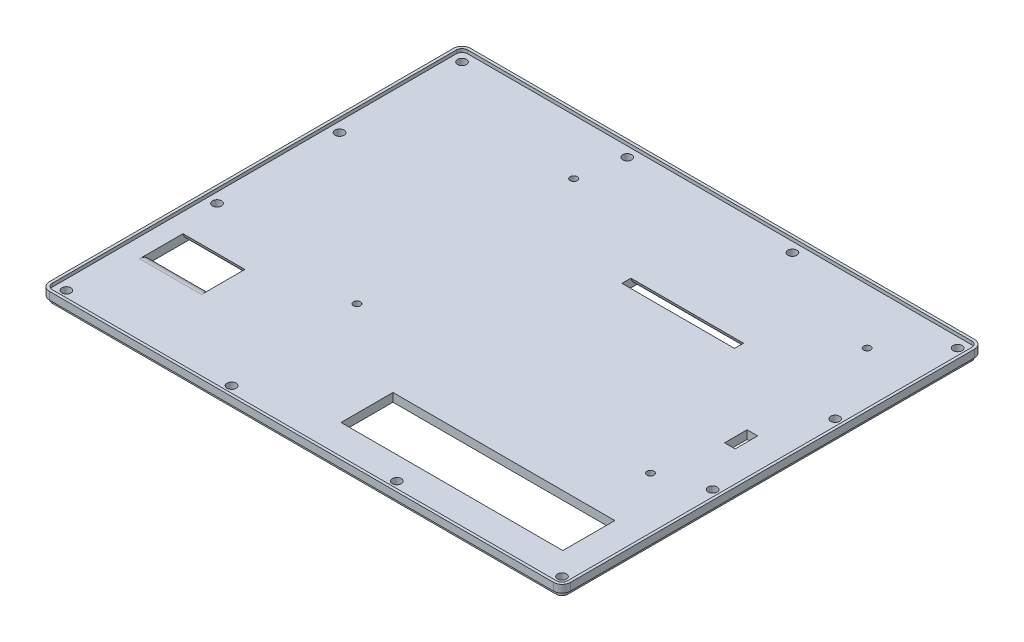
from build123d import *

# Parameters (mm, degrees)
SKETCH1_W           = 164.87
SKETCH1_H           = 104.3
SKETCH1_W_2         = 154.97
SKETCH1_H_2         = 94.47
BOSS_EXTRUDE1_DEPTH = 3
CUT_EXTRUDE9_START  = -1.5
CUT_EXTRUDE9_DEPTH  = 1.5
SKETCH8_W           = 78.76
SKETCH8_H           = 18.45
CUT_EXTRUDE7_DEPTH  = 228.052779987
SKETCH3_W           = 22
SKETCH3_H           = 6.55
CUT_EXTRUDE4_DEPTH  = 228.052779987
CUT_EXTRUDE3_REACH  = 229.053
SKETCH2_R           = 1.6
BOSS_EXTRUDE2_START = -4.2
BOSS_EXTRUDE2_DEPTH = 1.2
SKETCH13_W          = 3.75
SKETCH13_H          = 8
SKETCH13_W_2        = 40
SKETCH13_H_2        = 3.2
SKETCH13_W_3        = 22
SKETCH13_H_3        = 5
CUT_EXTRUDE10_DEPTH = 228.071805603
FILLET1_R           = 4
SKETCH15_R          = 4.15
BOSS_EXTRUDE3_DEPTH = 2.2
SKETCH16_R          = 1.25
CUT_EXTRUDE11_DEPTH = 228.123149194


with BuildPart() as part:
    # Sketch1 → Boss-Extrude1 (new body)
    # profile 1 of 3: a face of its own
    with BuildSketch(Plane(origin=(0, 0, 0), x_dir=(1, 0, 0), z_dir=(0, 1, 0))):
        with BuildLine():
            ThreePointArc((174.2, 7.54), (176.321320344, 6.661320344), (177.2, 4.54))
            Line((177.2, 4.54), (177.2, -138.93))
            ThreePointArc((177.2, -138.93), (176.321320344, -141.051320344), (174.2, -141.93))
            Line((174.2, -141.93), (-4.77, -141.93))
            ThreePointArc((-4.77, -141.93), (-6.891320344, -141.051320344), (-7.77, -138.93))
            Line((-7.77, -138.93), (-7.77, 4.54))
            ThreePointArc((-7.77, 4.54), (-6.891320344, 6.661320344), (-4.77, 7.54))
            Line((-4.77, 7.54), (174.2, 7.54))
        make_face()
        with Locations((82.435, -52.15)):
            Rectangle(SKETCH1_W, SKETCH1_H, mode=Mode.SUBTRACT)
    # profile 2 of 3: a face of its own
    with BuildSketch(Plane(origin=(0, 0, 0), x_dir=(1, 0, 0), z_dir=(0, 1, 0))):
        with Locations((82.435, -52.15)):
            Rectangle(SKETCH1_W, SKETCH1_H)
        with Locations((84.715, -54.695)):
            Rectangle(SKETCH1_W_2, SKETCH1_H_2, mode=Mode.SUBTRACT)
    # profile 3 of 3: a face of its own
    with BuildSketch(Plane(origin=(0, 0, 0), x_dir=(1, 0, 0), z_dir=(0, 1, 0))):
        with Locations((84.715, -54.695)):
            Rectangle(SKETCH1_W_2, SKETCH1_H_2)
    extrude(amount=-BOSS_EXTRUDE1_DEPTH)

    # Sketch12 → Cut-Extrude9 (cut)
    with BuildSketch(Plane.XZ.offset(3).offset(CUT_EXTRUDE9_START)):
        with BuildLine():
            Line((-4.77, -7.54), (174.2, -7.54))
            ThreePointArc((174.2, -7.54), (176.321320344, -6.661320344), (177.2, -4.54))
            Line((177.2, -4.54), (177.2, 138.93))
            ThreePointArc((177.2, 138.93), (176.321320344, 141.051320344), (174.2, 141.93))
            Line((174.2, 141.93), (-4.77, 141.93))
            ThreePointArc((-4.77, 141.93), (-6.891320344, 141.051320344), (-7.77, 138.93))
            Line((-7.77, 138.93), (-7.77, -4.54))
            ThreePointArc((-7.77, -4.54), (-6.891320344, -6.661320344), (-4.77, -7.54))
        make_face()
        with BuildLine():
            Line((176.2, -4.54), (176.2, 138.93))
            ThreePointArc((176.2, 138.93), (175.614213562, 140.344213562), (174.2, 140.93))
            Line((174.2, 140.93), (-4.77, 140.93))
            ThreePointArc((-4.77, 140.93), (-6.184213562, 140.344213562), (-6.77, 138.93))
            Line((-6.77, 138.93), (-6.77, -4.54))
            ThreePointArc((-6.77, -4.54), (-6.184213562, -5.954213562), (-4.77, -6.54))
            Line((-4.77, -6.54), (174.2, -6.54))
            ThreePointArc((174.2, -6.54), (175.614213562, -5.954213562), (176.2, -4.54))
        make_face(mode=Mode.SUBTRACT)
    extrude(amount=CUT_EXTRUDE9_DEPTH, mode=Mode.SUBTRACT)

    # Sketch8 → Cut-Extrude7 (cut, through all)
    with BuildSketch(Plane.XZ.offset(3)):
        with Locations((125.49, 120.075)):
            Rectangle(SKETCH8_W, SKETCH8_H)
    extrude(amount=-CUT_EXTRUDE7_DEPTH, mode=Mode.SUBTRACT)

    # Sketch3 → Cut-Extrude4 (cut, through all)
    with BuildSketch(Plane(origin=(0, -3, 0), x_dir=(-1, 0, 0), z_dir=(0, -1, 0))):
        with Locations((-11, -107.575)):
            Rectangle(SKETCH3_W, SKETCH3_H)
    extrude(amount=-CUT_EXTRUDE4_DEPTH, mode=Mode.SUBTRACT)

    # Sketch2 → Cut-Extrude3 (cut, up to next)
    with BuildSketch(Plane.XZ.offset(3), mode=Mode.PRIVATE) as cut_extrude3_sk1:
        with Locations(Location((172.7, -3.04, 0), (0, 0, 270))):
            Circle(SKETCH2_R)
    cut_extrude3_tool1 = extrude(cut_extrude3_sk1.sketch, amount=-CUT_EXTRUDE3_REACH, mode=Mode.PRIVATE) & part.part
    # Sketch2 → Cut-Extrude3 (cut, up to next)
    with BuildSketch(Plane.XZ.offset(3), mode=Mode.PRIVATE) as cut_extrude3_sk2:
        with Locations(Location((114.05, -3.04, 0), (0, 0, 270))):
            Circle(SKETCH2_R)
    cut_extrude3_tool2 = extrude(cut_extrude3_sk2.sketch, amount=-CUT_EXTRUDE3_REACH, mode=Mode.PRIVATE) & part.part
    # Sketch2 → Cut-Extrude3 (cut, up to next)
    with BuildSketch(Plane.XZ.offset(3), mode=Mode.PRIVATE) as cut_extrude3_sk3:
        with Locations(Location((-3.27, -3.04, 0), (0, 0, 270))):
            Circle(SKETCH2_R)
    cut_extrude3_tool3 = extrude(cut_extrude3_sk3.sketch, amount=-CUT_EXTRUDE3_REACH, mode=Mode.PRIVATE) & part.part
    # Sketch2 → Cut-Extrude3 (cut, up to next)
    with BuildSketch(Plane.XZ.offset(3), mode=Mode.PRIVATE) as cut_extrude3_sk4:
        with Locations(Location((-3.27, 83.94, 0), (0, 0, 270))):
            Circle(SKETCH2_R)
    cut_extrude3_tool4 = extrude(cut_extrude3_sk4.sketch, amount=-CUT_EXTRUDE3_REACH, mode=Mode.PRIVATE) & part.part
    # Sketch2 → Cut-Extrude3 (cut, up to next)
    with BuildSketch(Plane.XZ.offset(3), mode=Mode.PRIVATE) as cut_extrude3_sk5:
        with Locations(Location((-3.27, 137.43, 0), (0, 0, 270))):
            Circle(SKETCH2_R)
    cut_extrude3_tool5 = extrude(cut_extrude3_sk5.sketch, amount=-CUT_EXTRUDE3_REACH, mode=Mode.PRIVATE) & part.part
    # Sketch2 → Cut-Extrude3 (cut, up to next)
    with BuildSketch(Plane.XZ.offset(3), mode=Mode.PRIVATE) as cut_extrude3_sk6:
        with Locations(Location((55.38, 137.43, 0), (0, 0, 270))):
            Circle(SKETCH2_R)
    cut_extrude3_tool6 = extrude(cut_extrude3_sk6.sketch, amount=-CUT_EXTRUDE3_REACH, mode=Mode.PRIVATE) & part.part
    # Sketch2 → Cut-Extrude3 (cut, up to next)
    with BuildSketch(Plane.XZ.offset(3), mode=Mode.PRIVATE) as cut_extrude3_sk7:
        with Locations(Location((114.05, 137.43, 0), (0, 0, 270))):
            Circle(SKETCH2_R)
    cut_extrude3_tool7 = extrude(cut_extrude3_sk7.sketch, amount=-CUT_EXTRUDE3_REACH, mode=Mode.PRIVATE) & part.part
    # Sketch2 → Cut-Extrude3 (cut, up to next)
    with BuildSketch(Plane.XZ.offset(3), mode=Mode.PRIVATE) as cut_extrude3_sk8:
        with Locations(Location((172.7, 137.43, 0), (0, 0, 270))):
            Circle(SKETCH2_R)
    cut_extrude3_tool8 = extrude(cut_extrude3_sk8.sketch, amount=-CUT_EXTRUDE3_REACH, mode=Mode.PRIVATE) & part.part
    # Sketch2 → Cut-Extrude3 (cut, up to next)
    with BuildSketch(Plane.XZ.offset(3), mode=Mode.PRIVATE) as cut_extrude3_sk9:
        with Locations(Location((172.7, 83.94, 0), (0, 0, 270))):
            Circle(SKETCH2_R)
    cut_extrude3_tool9 = extrude(cut_extrude3_sk9.sketch, amount=-CUT_EXTRUDE3_REACH, mode=Mode.PRIVATE) & part.part
    # Sketch2 → Cut-Extrude3 (cut, up to next)
    with BuildSketch(Plane.XZ.offset(3), mode=Mode.PRIVATE) as cut_extrude3_sk10:
        with Locations(Location((172.7, 40.45, 0), (0, 0, 270))):
            Circle(SKETCH2_R)
    cut_extrude3_tool10 = extrude(cut_extrude3_sk10.sketch, amount=-CUT_EXTRUDE3_REACH, mode=Mode.PRIVATE) & part.part
    # Sketch2 → Cut-Extrude3 (cut, up to next)
    with BuildSketch(Plane.XZ.offset(3), mode=Mode.PRIVATE) as cut_extrude3_sk11:
        with Locations(Location((55.38, -3.04, 0), (0, 0, 270))):
            Circle(SKETCH2_R)
    cut_extrude3_tool11 = extrude(cut_extrude3_sk11.sketch, amount=-CUT_EXTRUDE3_REACH, mode=Mode.PRIVATE) & part.part
    # Sketch2 → Cut-Extrude3 (cut, up to next)
    with BuildSketch(Plane.XZ.offset(3), mode=Mode.PRIVATE) as cut_extrude3_sk12:
        with Locations(Location((-3.27, 40.45, 0), (0, 0, 270))):
            Circle(SKETCH2_R)
    cut_extrude3_tool12 = extrude(cut_extrude3_sk12.sketch, amount=-CUT_EXTRUDE3_REACH, mode=Mode.PRIVATE) & part.part
    add(cut_extrude3_tool1.solids().sort_by_distance((172.7, -3, -3.04))[0], mode=Mode.SUBTRACT)
    add(cut_extrude3_tool2.solids().sort_by_distance((114.05, -3, -3.04))[0], mode=Mode.SUBTRACT)
    add(cut_extrude3_tool3.solids().sort_by_distance((-3.27, -3, -3.04))[0], mode=Mode.SUBTRACT)
    add(cut_extrude3_tool4.solids().sort_by_distance((-3.27, -3, 83.94))[0], mode=Mode.SUBTRACT)
    add(cut_extrude3_tool5.solids().sort_by_distance((-3.27, -3, 137.43))[0], mode=Mode.SUBTRACT)
    add(cut_extrude3_tool6.solids().sort_by_distance((55.38, -3, 137.43))[0], mode=Mode.SUBTRACT)
    add(cut_extrude3_tool7.solids().sort_by_distance((114.05, -3, 137.43))[0], mode=Mode.SUBTRACT)
    add(cut_extrude3_tool8.solids().sort_by_distance((172.7, -3, 137.43))[0], mode=Mode.SUBTRACT)
    add(cut_extrude3_tool9.solids().sort_by_distance((172.7, -3, 83.94))[0], mode=Mode.SUBTRACT)
    add(cut_extrude3_tool10.solids().sort_by_distance((172.7, -3, 40.45))[0], mode=Mode.SUBTRACT)
    add(cut_extrude3_tool11.solids().sort_by_distance((55.38, -3, -3.04))[0], mode=Mode.SUBTRACT)
    add(cut_extrude3_tool12.solids().sort_by_distance((-3.27, -3, 40.45))[0], mode=Mode.SUBTRACT)

    # Sketch12<2> → Boss-Extrude2 (add)
    with BuildSketch(Plane.XZ.offset(3).offset(BOSS_EXTRUDE2_START)):
        with BuildLine():
            Line((-4.77, -7.54), (174.2, -7.54))
            ThreePointArc((174.2, -7.54), (176.321320344, -6.661320344), (177.2, -4.54))
            Line((177.2, -4.54), (177.2, 138.93))
            ThreePointArc((177.2, 138.93), (176.321320344, 141.051320344), (174.2, 141.93))
            Line((174.2, 141.93), (-4.77, 141.93))
            ThreePointArc((-4.77, 141.93), (-6.891320344, 141.051320344), (-7.77, 138.93))
            Line((-7.77, 138.93), (-7.77, -4.54))
            ThreePointArc((-7.77, -4.54), (-6.891320344, -6.661320344), (-4.77, -7.54))
        make_face()
        with BuildLine():
            Line((176.2, -4.54), (176.2, 138.93))
            ThreePointArc((176.2, 138.93), (175.614213562, 140.344213562), (174.2, 140.93))
            Line((174.2, 140.93), (-4.77, 140.93))
            ThreePointArc((-4.77, 140.93), (-6.184213562, 140.344213562), (-6.77, 138.93))
            Line((-6.77, 138.93), (-6.77, -4.54))
            ThreePointArc((-6.77, -4.54), (-6.184213562, -5.954213562), (-4.77, -6.54))
            Line((-4.77, -6.54), (174.2, -6.54))
            ThreePointArc((174.2, -6.54), (175.614213562, -5.954213562), (176.2, -4.54))
        make_face(mode=Mode.SUBTRACT)
    extrude(amount=BOSS_EXTRUDE2_DEPTH)

    # Sketch13 → Cut-Extrude10 (cut, through all)
    with BuildSketch(Plane(origin=(0, -3, 0), x_dir=(-1, 0, 0), z_dir=(0, -1, 0))):
        with Locations((-162.325, -63.46)):
            Rectangle(SKETCH13_W, SKETCH13_H)
        with Locations((-113.2, -35.06)):
            Rectangle(SKETCH13_W_2, SKETCH13_H_2)
        with Locations((-11, -101.8)):
            Rectangle(SKETCH13_W_3, SKETCH13_H_3)
    extrude(amount=-CUT_EXTRUDE10_DEPTH, mode=Mode.SUBTRACT)

    # Fillet1
    # the kernel refuses this fillet: 4 mm, written as the material it takes off along each edge
    with BuildSketch(Plane(origin=(133.2, -3, 33.46), x_dir=(0, 0, -1), z_dir=(-1, 0, 0))) as fillet1_piece_1:
        with BuildLine():
            CenterArc((3.872983346, -4), FILLET1_R, 90, 75.522487814)
            Line((0, -3), (0, 0))
            Line((0, 0), (3.872983346, 0))
        make_face()
    extrude(amount=40, mode=Mode.SUBTRACT)
    with BuildSketch(Plane(origin=(0, 0, 110.85), x_dir=(0, 0, 1), z_dir=(1, 0, 0)), Plane(origin=(0, -3, 99.3), x_dir=(0, 0, -1), z_dir=(1, 0, 0))) as fillet1_piece_2:
        with BuildLine():
            CenterArc((3.872983346, 4), FILLET1_R, 194.477512186, 75.522487814)
            Line((0, 3), (0, 0))
            Line((0, 0), (3.872983346, 0))
        make_face()
    extrude(amount=22, mode=Mode.SUBTRACT)

    # Sketch15 → Boss-Extrude3 (add)
    with BuildSketch(Plane.XZ.offset(3)):
        with Locations(Location((156.64, 13.02, 0), (0, 0, 90))):
            Circle(SKETCH15_R)
        with Locations(Location((52.44, 13.02, 0), (0, 0, 90))):
            Circle(SKETCH15_R)
        with Locations(Location((156.64, 89.96, 0), (0, 0, 90))):
            Circle(SKETCH15_R)
        with Locations(Location((52.44, 89.96, 0), (0, 0, 90))):
            Circle(SKETCH15_R)
    extrude(amount=BOSS_EXTRUDE3_DEPTH)

    # Sketch16 → Cut-Extrude11 (cut, through all)
    with BuildSketch(Plane.XZ.offset(5.2)):
        with Locations(Location((156.64, 13.02, 0), (0, 0, 270))):
            Circle(SKETCH16_R)
        with Locations(Location((156.64, 89.96, 0), (0, 0, 270))):
            Circle(SKETCH16_R)
        with Locations(Location((52.44, 89.96, 0), (0, 0, 270))):
            Circle(SKETCH16_R)
        with Locations(Location((52.44, 13.02, 0), (0, 0, 270))):
            Circle(SKETCH16_R)
    extrude(amount=-CUT_EXTRUDE11_DEPTH, mode=Mode.SUBTRACT)


solid = part.part
